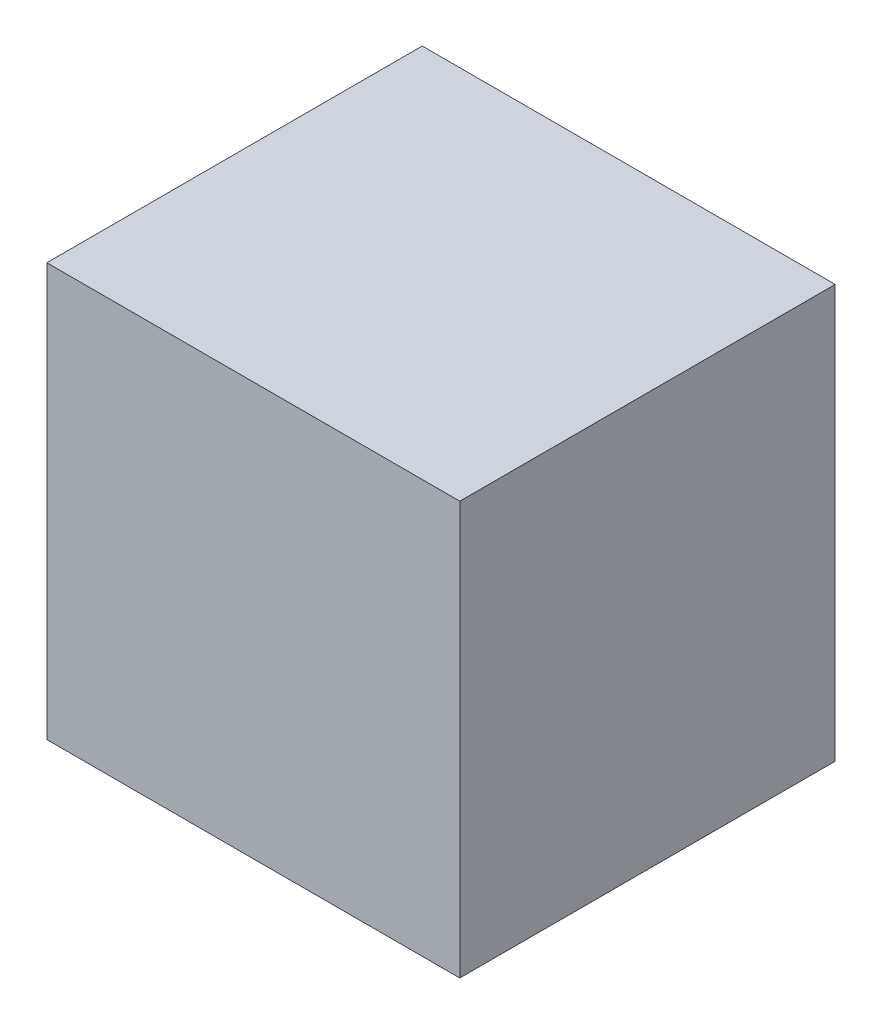
from build123d import *

# Parameters (mm, degrees)
SKETCH1_W           = 22
SKETCH1_H           = 22
BOSS_EXTRUDE1_DEPTH = 20


with BuildPart() as part:
    # Sketch1 → Boss-Extrude1 (new body)
    with BuildSketch(Plane.XY):
        with Locations((1, 5)):
            Rectangle(SKETCH1_W, SKETCH1_H)
    extrude(amount=BOSS_EXTRUDE1_DEPTH)


solid = part.part
